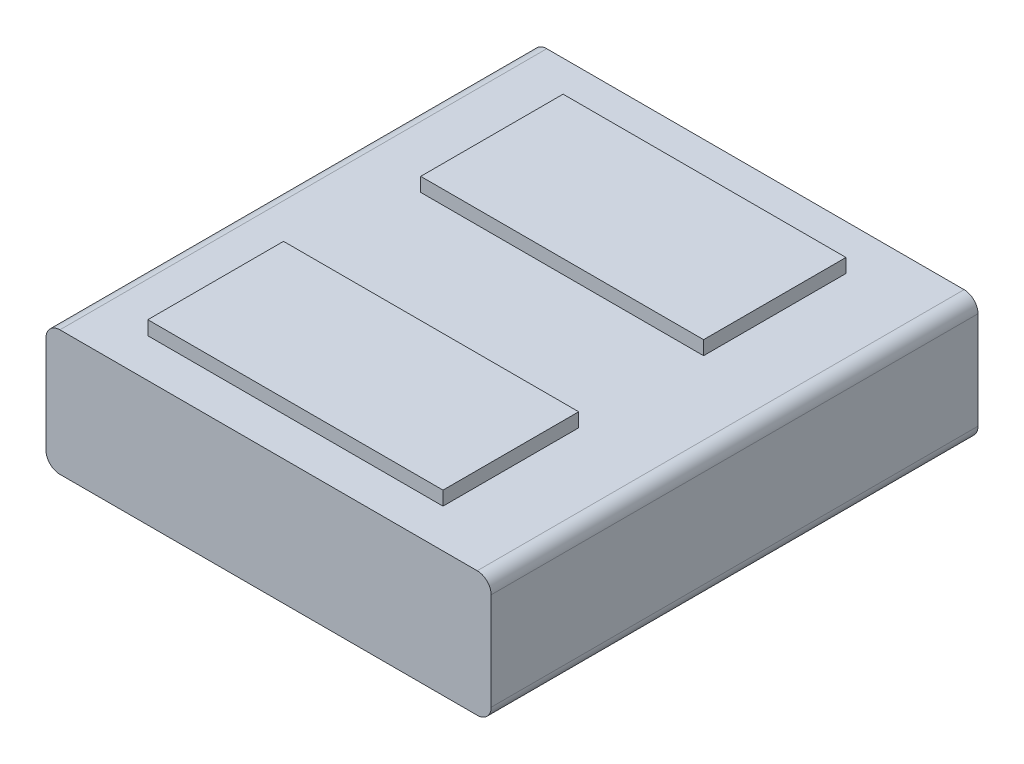
from build123d import *

# Parameters (mm, degrees)
SKETCH_1_W        = 64
SKETCH_1_H        = 18
EXTRUDE_1_DEPTH   = 70
FILLET_1_R        = 2
SKETCH_2_W        = 42.438172009
SKETCH_2_H        = 19.50989992
EXTRUDE_2_DEPTH   = 2
SKETCH_2_W_2      = 40.669439651
SKETCH_2_H_2      = 20.470186346
EXTRUDE_2_2_DEPTH = 2


with BuildPart() as part:
    # 草圖1 → 填料-伸長1 (new body)
    with BuildSketch(Plane.XY):
        with Locations((32, 9)):
            Rectangle(SKETCH_1_W, SKETCH_1_H)
    extrude(amount=EXTRUDE_1_DEPTH)

    # 圓角1
    fillet_1_edges = [part.edges().sort_by_distance(p)[0] for p in [
        (64, 0, 35),
        (0, 0, 35),
        (0, 18, 35),
        (64, 18, 35),
    ]]
    fillet(fillet_1_edges, radius=FILLET_1_R)


with BuildPart() as body_2:
    # 草圖2 → 填料-伸長2 (new body)
    with BuildSketch(Plane(origin=(0, 18, 0), x_dir=(1, 0, 0), z_dir=(0, 1, 0))):
        with Locations((30.280601754, -54.666211253)):
            Rectangle(SKETCH_2_W, SKETCH_2_H)
    extrude(amount=EXTRUDE_2_DEPTH)


with BuildPart() as body_3:
    # 草圖2 → Extrude 2 2 (new body)
    with BuildSketch(Plane(origin=(0, 18, 0), x_dir=(1, 0, 0), z_dir=(0, 1, 0))):
        with Locations((31.164967933, -16.72022809)):
            Rectangle(SKETCH_2_W_2, SKETCH_2_H_2)
    extrude(amount=EXTRUDE_2_2_DEPTH)


solid = Compound([part.part, body_2.part, body_3.part])
